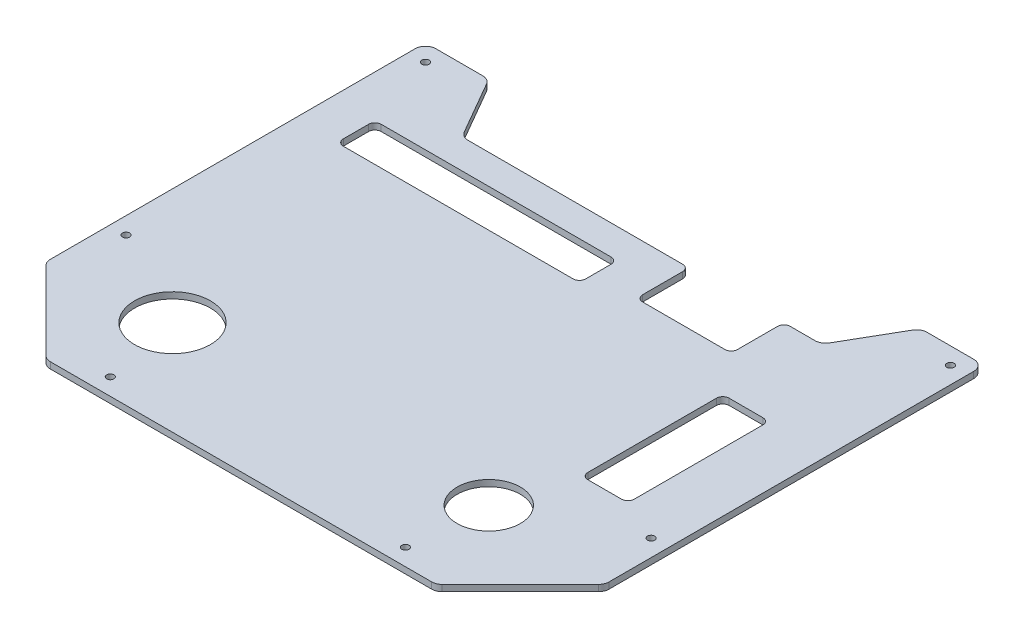
from build123d import *

# Parameters (mm, degrees)
BOSS_EXTRU_1_DEPTH      = 3
CONG_1_R                = 5
ESQUISSE2_R             = 1
ENL_V_MAT_EXTRU_1_DEPTH = 257.837010573
D_GAGEMENT_M31_D        = 3.4
ESQUISSE5_R             = 18
ESQUISSE5_R_2           = 15
ESQUISSE5_W             = 45
ESQUISSE5_H             = 25
ESQUISSE5_W_2           = 115
ESQUISSE5_H_2           = 18
ESQUISSE5_W_3           = 22
ESQUISSE5_H_3           = 67
ENL_V_MAT_EXTRU_2_DEPTH = 257.837010573
CONG_2_R                = 3


with BuildPart() as part:
    # Esquisse1 → Boss.-Extru.1 (new body)
    with BuildSketch(Plane(origin=(0, 0, 0), x_dir=(1, 0, 0), z_dir=(0, 1, 0))):
        Polygon((-92.5, 0), (92.5, 0), (132.5, 40), (132.5, 220), (102.5, 220), (85.179491924, 190), (-85.179491924, 190), (-102.5, 220), (-132.5, 220), (-132.5, 40), align=None)
    extrude(amount=BOSS_EXTRU_1_DEPTH)

    # Congé1
    cong_1_edges = [part.edges().sort_by_distance(p)[0] for p in [
        (132.5, 1.5, -220),
        (102.5, 1.5, -220),
        (85.179491924, 1.5, -190),
        (-85.179491924, 1.5, -190),
        (-102.5, 1.5, -220),
        (-132.5, 1.5, -220),
        (-132.5, 1.5, -40),
        (-92.5, 1.5, 0),
        (92.5, 1.5, 0),
        (132.5, 1.5, -40),
    ]]
    fillet(cong_1_edges, radius=CONG_1_R)

    # Esquisse2 → Enlèv. mat.-Extru.1 (cut, through all)
    with BuildSketch(Plane.XZ):
        with Locations((-70, -8)):
            Circle(ESQUISSE2_R)
        with Locations((-124.5, -70)):
            Circle(ESQUISSE2_R)
        with Locations((-124.5, -212)):
            Circle(ESQUISSE2_R)
        with Locations((124.5, -212)):
            Circle(ESQUISSE2_R)
        with Locations((124.5, -70)):
            Circle(ESQUISSE2_R)
        with Locations((70, -8)):
            Circle(ESQUISSE2_R)
    extrude(amount=-ENL_V_MAT_EXTRU_1_DEPTH, mode=Mode.SUBTRACT)

    # Dégagement M31 (through all)
    with Locations(Plane(origin=(0, 0, 0), x_dir=(-1, 0, 0), z_dir=(0, -1, 0))):
        with Locations((-70, 8), (-124.5, 70), (-124.5, 212), (124.5, 212), (124.5, 70), (70, 8)):
            Hole(D_GAGEMENT_M31_D / 2)

    # Esquisse5 → Enlèv. mat.-Extru.2 (cut, through all)
    with BuildSketch(Plane.XZ):
        with Locations((-77.5, -45)):
            Circle(ESQUISSE5_R)
        with Locations((72.5, -45)):
            Circle(ESQUISSE5_R_2)
        with Locations((45, -177.5)):
            Rectangle(ESQUISSE5_W, ESQUISSE5_H)
        with Locations((-55, -167)):
            Rectangle(ESQUISSE5_W_2, ESQUISSE5_H_2)
        with Locations((93.5, -112.5)):
            Rectangle(ESQUISSE5_W_3, ESQUISSE5_H_3)
    extrude(amount=-ENL_V_MAT_EXTRU_2_DEPTH, mode=Mode.SUBTRACT)

    # Congé2
    cong_2_edges = [part.edges().sort_by_distance(p)[0] for p in [
        (67.5, 1.5, -190),
        (67.5, 1.5, -165),
        (22.5, 1.5, -165),
        (22.5, 1.5, -190),
        (104.5, 1.5, -146),
        (82.5, 1.5, -146),
        (82.5, 1.5, -79),
        (104.5, 1.5, -79),
        (2.5, 1.5, -158),
        (2.5, 1.5, -176),
        (-112.5, 1.5, -158),
        (-112.5, 1.5, -176),
    ]]
    fillet(cong_2_edges, radius=CONG_2_R)


solid = part.part
